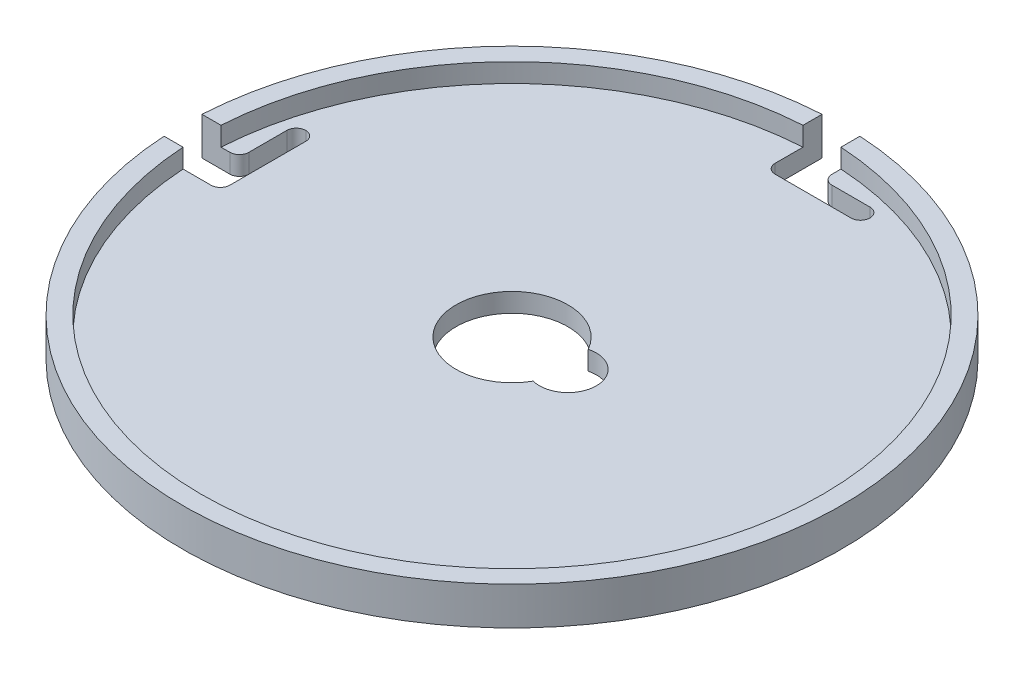
from build123d import *

# Parameters (mm, degrees)
SKETCH1_R                     = 32.75
OUTER_DISK_DEPTH              = 2
ENCLOSEMENT_T                 = 2
HOOK_RELEASE_DEPTH            = 50.184601249
CIRPATTERN1_COUNT             = 2
CIRPATTERN1_ANGLE             = 90
SERVO_MOTOR_CUTOUT_DEPTH      = 50.184601249
SERVO_MOTOR_CUTOUT_DEPTH_BACK = 50.184601249
SKETCH3_R                     = 3
SKETCH3_R_2                   = 5.9
FILLET1_R                     = 1


with BuildPart() as part:
    # Sketch1 → Outer DIsk (new body)
    with BuildSketch(Plane(origin=(0, 0, 0), x_dir=(1, 0, 0), z_dir=(0, 1, 0))):
        with Locations(Location((0, 0, 0), (0, 0, 270))):
            Circle(SKETCH1_R)
    extrude(amount=OUTER_DISK_DEPTH)

    # Enclosement
    enclosement_openings = [part.faces().sort_by_distance(p)[0] for p in [
        (0, 2, 0),
    ]]
    offset(amount=ENCLOSEMENT_T, openings=enclosement_openings, kind=Kind.INTERSECTION)

    # Sketch2 → Hook Release (cut, symmetric)
    with BuildSketch(Plane(origin=(0, 0, 0), x_dir=(1, 0, 0), z_dir=(0, 1, 0))):
        Polygon((-2, 34.75), (-2, 28.75), (8, 28.75), (8, 30.75), (2, 30.75), (2, 34.75), align=None)
    hook_release = extrude(amount=HOOK_RELEASE_DEPTH, both=True, mode=Mode.SUBTRACT)

    # CirPattern1: Hook Release ×2 about axis
    cirpattern1_axis = Axis((0, 0, 0), (0, 1, 0))
    for i in range(1, CIRPATTERN1_COUNT):
        add(hook_release.rotate(cirpattern1_axis, i * CIRPATTERN1_ANGLE / (CIRPATTERN1_COUNT - 1)), mode=Mode.SUBTRACT)

    # Sketch3 → Servo Motor Cutout (cut, two sides: drawn at the far end of the back side and taken through both)
    with BuildSketch(Plane(origin=(0, 0, 0), x_dir=(1, 0, 0), z_dir=(0, 1, 0)).offset(-SERVO_MOTOR_CUTOUT_DEPTH_BACK)):
        with Locations((5.9, 0)):
            Circle(SKETCH3_R)
        Circle(SKETCH3_R_2)
    extrude(amount=SERVO_MOTOR_CUTOUT_DEPTH + SERVO_MOTOR_CUTOUT_DEPTH_BACK, mode=Mode.SUBTRACT)

    # Fillet1
    fillet1_edges = [part.edges().sort_by_distance(p)[0] for p in [
        (-28.75, -1, 2),
        (-28.75, -1, -8),
        (-30.75, -1, -8),
        (-30.75, -1, -2),
        (8, -1, -28.75),
        (-2, -1, -28.75),
        (8, -1, -30.75),
        (2, -1, -30.75),
    ]]
    fillet(fillet1_edges, radius=FILLET1_R - 0.0001)  # a hair under: the kernel refuses the full size


solid = part.part
